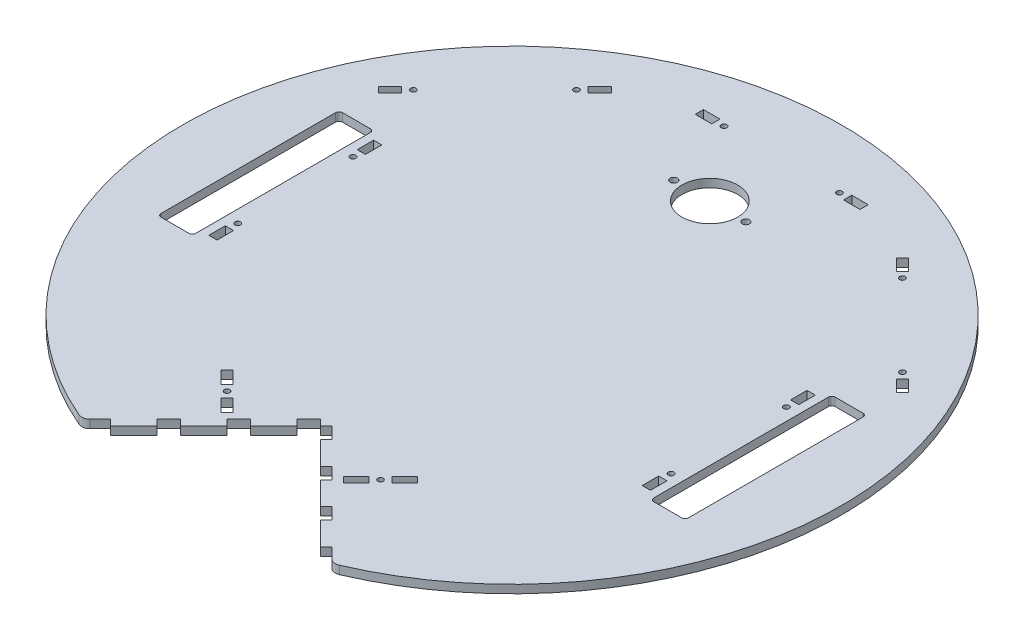
from build123d import *

# Parameters (mm, degrees)
SKETCH1_R           = 254
BOSS_EXTRUDE1_DEPTH = 6.35
CUT_EXTRUDE2_DEPTH  = 360.266367059
CUT_EXTRUDE4_DEPTH  = 360.266367059
SKETCH6_R           = 2.0955
CUT_EXTRUDE6_DEPTH  = 360.266367059
SKETCH8_R           = 2.1336
SKETCH8_W           = 6.35
SKETCH8_H           = 12.7
CUT_EXTRUDE7_DEPTH  = 360.266367059
SKETCH9_R           = 2.1336
SKETCH9_W           = 12.7
SKETCH9_H           = 6.35
CUT_EXTRUDE8_DEPTH  = 360.266367059
SKETCH10_R          = 2.1336
CUT_EXTRUDE9_DEPTH  = 360.266367059
SKETCH11_R          = 21.463
SKETCH11_R_2        = 2.778125
CUT_EXTRUDE10_DEPTH = 360.266367059
SKETCH12_W          = 25.4
SKETCH12_H          = 6.35
SKETCH12_W_2        = 12.7
CUT_EXTRUDE11_DEPTH = 6.35
FILLET1_R           = 6.35


with BuildPart() as part:
    # Sketch1 → Boss-Extrude1 (new body)
    with BuildSketch(Plane(origin=(0, 0, 0), x_dir=(1, 0, 0), z_dir=(0, 1, 0))):
        Circle(SKETCH1_R)
    extrude(amount=BOSS_EXTRUDE1_DEPTH)

    # Sketch2 → Cut-Extrude2 (cut, through all)
    with BuildSketch(Plane(origin=(0, 6.35, 0), x_dir=(1, 0, 0), z_dir=(0, 1, 0))):
        with BuildLine():
            Line((0, -147.792682849), (-89.802561211, -237.59524406))
            ThreePointArc((-89.802561211, -237.59524406), (0, -254), (89.802561211, -237.59524406))
            Line((89.802561211, -237.59524406), (0, -147.792682849))
        make_face()
    extrude(amount=-CUT_EXTRUDE2_DEPTH, mode=Mode.SUBTRACT)

    # Sketch4 → Cut-Extrude4 (cut, through all)
    with BuildSketch(Plane(origin=(0, 6.35, 0), x_dir=(1, 0, 0), z_dir=(0, 1, 0))):
        with BuildLine():
            Line((-200.66, 69.85), (-179.07, 69.85))
            ThreePointArc((-179.07, 69.85), (-177.273948776, 69.106051224), (-176.53, 67.31))
            Line((-176.53, 67.31), (-176.53, -67.31))
            ThreePointArc((-176.53, -67.31), (-177.273948776, -69.106051224), (-179.07, -69.85))
            Line((-179.07, -69.85), (-200.66, -69.85))
            ThreePointArc((-200.66, -69.85), (-202.456051224, -69.106051224), (-203.2, -67.31))
            Line((-203.2, -67.31), (-203.2, 67.31))
            ThreePointArc((-203.2, 67.31), (-202.456051224, 69.106051224), (-200.66, 69.85))
        make_face()
    cut_extrude4 = extrude(amount=-CUT_EXTRUDE4_DEPTH, mode=Mode.SUBTRACT)

    # Mirror2: Cut-Extrude4 across plane
    add(cut_extrude4.mirror(Plane(origin=(0, 0, 0), x_dir=(0, 0, 1), z_dir=(1, 0, 0))), mode=Mode.SUBTRACT)

    # Sketch6 → Cut-Extrude6 (cut, through all)
    with BuildSketch(Plane(origin=(0, 6.35, 0), x_dir=(1, 0, 0), z_dir=(0, 1, 0))):
        with Locations((-59.123400668, -160.51133115)):
            Circle(SKETCH6_R)
        Polygon((-61.368464698, -153.77613906), (-71.1004567, -144.044147058), (-75.59058476, -148.534275118), (-65.858592758, -158.26626712), align=None)
        Polygon((-52.388208577, -162.756395181), (-42.656216575, -172.488387182), (-47.146344636, -176.978515243), (-56.878336637, -167.246523241), align=None)
    cut_extrude6 = extrude(amount=-CUT_EXTRUDE6_DEPTH, mode=Mode.SUBTRACT)

    # Mirror5: Cut-Extrude6 across plane
    add(cut_extrude6.mirror(Plane(origin=(0, 0, 0), x_dir=(0, 0, 1), z_dir=(1, 0, 0))), mode=Mode.SUBTRACT)

    # Sketch8 → Cut-Extrude7 (cut, through all)
    with BuildSketch(Plane.XZ):
        with Locations((-167.005, -44.45)):
            Circle(SKETCH8_R)
        with Locations((-167.005, 44.45)):
            Circle(SKETCH8_R)
        with Locations((-167.005, -57.15)):
            Rectangle(SKETCH8_W, SKETCH8_H)
        with Locations((-167.005, 57.15)):
            Rectangle(SKETCH8_W, SKETCH8_H)
    cut_extrude7 = extrude(amount=-CUT_EXTRUDE7_DEPTH, mode=Mode.SUBTRACT)

    # Mirror6: Cut-Extrude7 across plane
    add(cut_extrude7.mirror(Plane(origin=(0, 0, 0), x_dir=(0, 0, 1), z_dir=(1, 0, 0))), mode=Mode.SUBTRACT)

    # Sketch9 → Cut-Extrude8 (cut, through all)
    with BuildSketch(Plane.XZ):
        with Locations((-44.45, -207.81727558)):
            Circle(SKETCH9_R)
        with Locations((44.45, -207.81727558)):
            Circle(SKETCH9_R)
        with Locations((-57.15, -207.81727558)):
            Rectangle(SKETCH9_W, SKETCH9_H)
        with Locations((57.15, -207.81727558)):
            Rectangle(SKETCH9_W, SKETCH9_H)
    extrude(amount=-CUT_EXTRUDE8_DEPTH, mode=Mode.SUBTRACT)

    # Sketch10 → Cut-Extrude9 (cut, through all)
    with BuildSketch(Plane.XZ):
        with Locations((-188.470279928, -112.368300127)):
            Circle(SKETCH10_R)
        with Locations((-125.608487081, -175.230092975)):
            Circle(SKETCH10_R)
        Polygon((-204.18572814, -101.142979976), (-195.205472019, -110.123236097), (-190.715343959, -105.633108037), (-199.69560008, -96.652851915), align=None)
        Polygon((-123.363423051, -181.965285066), (-114.38316693, -190.945541187), (-109.893038869, -186.455413126), (-118.87329499, -177.475157005), align=None)
    cut_extrude9 = extrude(amount=-CUT_EXTRUDE9_DEPTH, mode=Mode.SUBTRACT)

    # Mirror7: Cut-Extrude9 across plane
    add(cut_extrude9.mirror(Plane(origin=(0, 0, 0), x_dir=(0, 0, 1), z_dir=(1, 0, 0))), mode=Mode.SUBTRACT)

    # Sketch11 → Cut-Extrude10 (cut, through all)
    with BuildSketch(Plane(origin=(0, 6.35, 0), x_dir=(1, 0, 0), z_dir=(0, 1, 0))):
        with Locations((0, 152.4)):
            Circle(SKETCH11_R)
        with Locations((27.78125, 152.4)):
            Circle(SKETCH11_R_2)
        with Locations((-27.78125, 152.4)):
            Circle(SKETCH11_R_2)
    extrude(amount=-CUT_EXTRUDE10_DEPTH, mode=Mode.SUBTRACT)

    # Sketch12 → Cut-Extrude11 (cut)
    with BuildSketch(Plane(origin=(73.896341425, 0, 73.896341425), x_dir=(0.7071067811865489, 0, -0.7071067811865462), z_dir=(0.7071067811865462, 0, 0.7071067811865489))):
        with Locations((-231.505208253, 3.175)):
            Rectangle(SKETCH12_W, SKETCH12_H)
        with Locations((-187.055208253, 3.175)):
            Rectangle(SKETCH12_W_2, SKETCH12_H)
        with Locations((-148.955208253, 3.175)):
            Rectangle(SKETCH12_W_2, SKETCH12_H)
        with Locations((-110.855208253, 3.175)):
            Rectangle(SKETCH12_W_2, SKETCH12_H)
    cut_extrude11 = extrude(amount=-CUT_EXTRUDE11_DEPTH, mode=Mode.SUBTRACT)

    # Mirror8: Cut-Extrude11 across plane
    add(cut_extrude11.mirror(Plane(origin=(0, 0, 0), x_dir=(0, 0, 1), z_dir=(1, 0, 0))), mode=Mode.SUBTRACT)

    # Fillet1
    fillet1_edges = [part.edges().sort_by_distance(p)[0] for p in [
        (96.246367498, 3.175, 235.058794227),
        (-96.246367498, 3.175, 235.058794227),
    ]]
    fillet(fillet1_edges, radius=FILLET1_R)


solid = part.part
